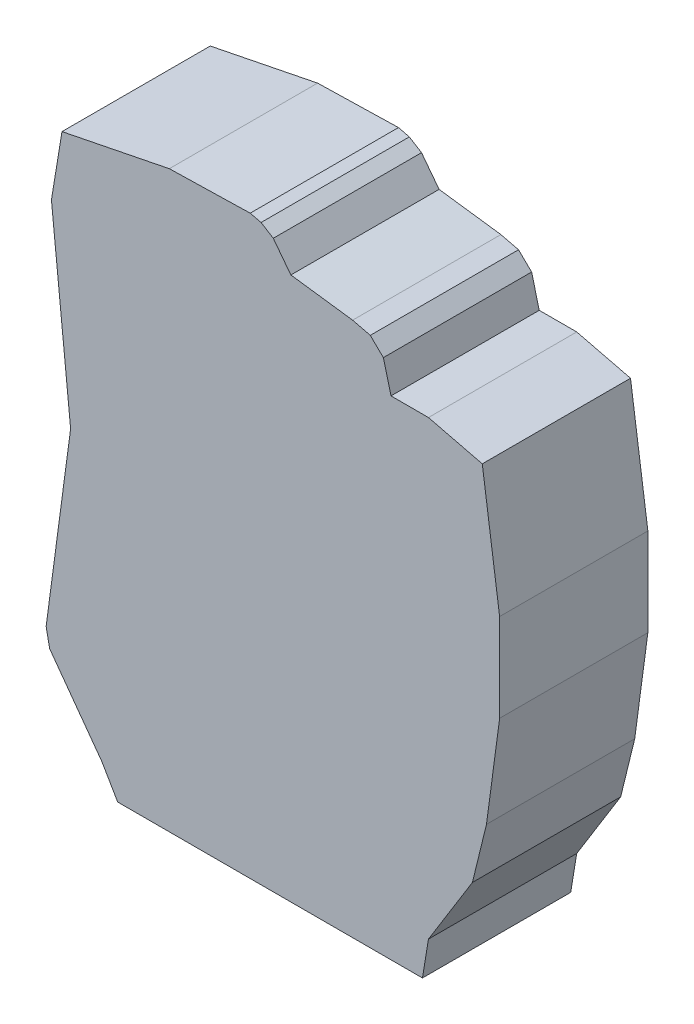
from build123d import *

# Parameters (mm, degrees)
BOSS_EXTRUDE1_DEPTH = 30


with BuildPart() as part:
    # Sketch1 → Boss-Extrude1 (new body)
    with BuildSketch(Plane.XY):
        Polygon((546.580924534, 9.896085679), (608.250924534, 9.896085679), (609.468725462, 17.325239217), (618.364062826, 31.698748766), (621.209508482, 43.308723045), (623.868380606, 63.224196603), (623.868380606, 81.054488799), (620.357339754, 106.059490311), (609.468725462, 108.728140515), (601.88762533, 108.728140515), (600.342350418, 114.668879106), (597.693307712, 117.244337292), (594.121848564, 118.119653006), (581.623216062, 119.788318601), (578.065152196, 124.442825109), (575.59297034, 125.972784898), (573.39799577, 126.510743097), (557.030037078, 126.118131563), (535.309704018, 121.76025213), (533.883150006, 113.057607434), (533.173455584, 108.728140515), (536.320171406, 77.786869686), (537.054893461, 70.562437811), (532.098682684, 33.439447285), (532.810591456, 29.891185826), (543.388975695, 15.373727724), align=None)
    extrude(amount=BOSS_EXTRUDE1_DEPTH)


solid = part.part
